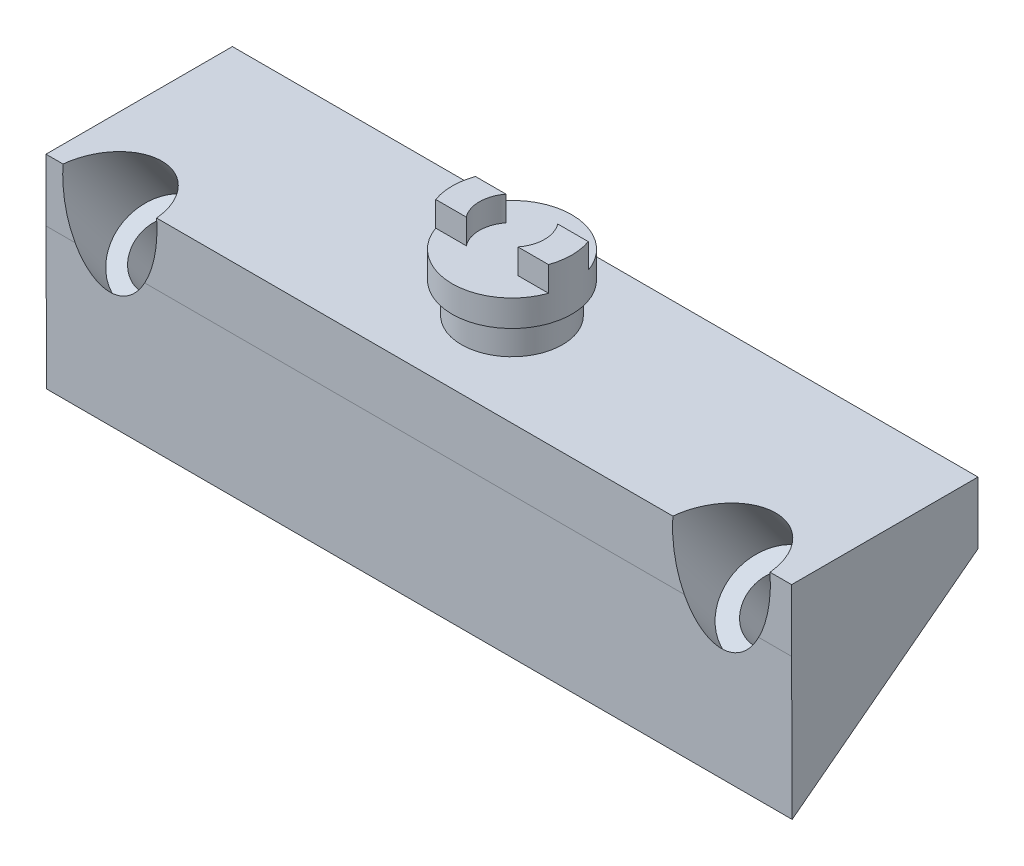
from build123d import *

# Parameters (mm, degrees)
SKETCH1_W                 = 48
SKETCH1_H                 = 12
BOSS_EXTRUDE2_DEPTH       = 4
SKETCH3_R                 = 3.25
BOSS_EXTRUDE3_DEPTH       = 2
SKETCH4_R                 = 3.85
BOSS_EXTRUDE4_DEPTH       = 3.3
SKETCH5_W                 = 10.744623103
SKETCH5_H                 = 3.104002229
SKETCH5_W_2               = 12.040799858
SKETCH5_H_2               = 4.707168217
CUT_EXTRUDE6_DEPTH        = 1.6
SKETCH6_R                 = 2.1
CUT_EXTRUDE7_DEPTH        = 1.6
BOSS_EXTRUDE5_DEPTH       = 48
SKETCH11_R                = 2
CUT_EXTRUDE12_DEPTH       = 46.960925441
CUT_EXTRUDE13_START       = -3.247821806
CUT_EXTRUDE13_OUTLINE_R   = 3.036171251
CUT_EXTRUDE13_OUTLINE_R_2 = 2
CUT_EXTRUDE13_OUTLINE_R_3 = 3.150431912
CUT_EXTRUDE13_DEPTH       = 6.452188627


# Read off the part's stored shape, not the designer's step: Cut-Extrude13
with BuildPart() as part:
    # Sketch1 → Boss-Extrude2 (new body)
    with BuildSketch(Plane(origin=(0, 0, 0), x_dir=(1, 0, 0), z_dir=(0, 1, 0))):
        with Locations((-18.755819717, 5.963784416)):
            Rectangle(SKETCH1_W, SKETCH1_H)
    extrude(amount=BOSS_EXTRUDE2_DEPTH)

    # Sketch3 → Boss-Extrude3 (add)
    with BuildSketch(Plane(origin=(0, 4, 0), x_dir=(1, 0, 0), z_dir=(0, 1, 0))):
        with Locations(Location((-18.755819717, 5.963784416, 0), (0, 0, 270))):
            Circle(SKETCH3_R)
    extrude(amount=BOSS_EXTRUDE3_DEPTH)

    # Sketch4 → Boss-Extrude4 (add)
    with BuildSketch(Plane(origin=(0, 6, 0), x_dir=(1, 0, 0), z_dir=(0, 1, 0))):
        with Locations(Location((-18.755819717, 5.963784416, 0), (0, 0, 270))):
            Circle(SKETCH4_R)
    extrude(amount=BOSS_EXTRUDE4_DEPTH)

    # Sketch5 → Cut-Extrude6 (cut)
    with BuildSketch(Plane(origin=(0, 9.3, 0), x_dir=(1, 0, 0), z_dir=(0, 1, 0))):
        with Locations((-18.784487645, 3.131783302)):
            Rectangle(SKETCH5_W, SKETCH5_H)
        with Locations((-18.682157901, 9.597368525)):
            Rectangle(SKETCH5_W_2, SKETCH5_H_2)
    extrude(amount=-CUT_EXTRUDE6_DEPTH, mode=Mode.SUBTRACT)

    # Sketch6 → Cut-Extrude7 (cut)
    with BuildSketch(Plane(origin=(0, 9.3, 0), x_dir=(1, 0, 0), z_dir=(0, 1, 0))):
        with Locations((-18.755819717, 5.963784416)):
            Circle(SKETCH6_R)
    extrude(amount=-CUT_EXTRUDE7_DEPTH, mode=Mode.SUBTRACT)

    # Sketch7 → Boss-Extrude5 (add)
    with BuildSketch(Plane(origin=(5.244180283, 0, 0), x_dir=(0, 0, -1), z_dir=(1, 0, 0))):
        Polygon((11.963784416, 0), (0, -9.109804798), (-0.036215584, 0), align=None)
    extrude(amount=-BOSS_EXTRUDE5_DEPTH)

    # Sketch11 → Cut-Extrude12 (cut, through all)
    with BuildSketch(Plane(origin=(0, -5.766415649, -4.390828112), x_dir=(1, 0, 0), z_dir=(0, -0.7956067081089262, -0.6058134746042532))):
        with Locations(Location((0.874180283, -1.977052592, 0), (0, 0, 270))):
            Circle(SKETCH11_R)
        with Locations(Location((-38.525819717, -1.977052592, 0), (0, 0, 270))):
            Circle(SKETCH11_R)
    extrude(amount=-CUT_EXTRUDE12_DEPTH, mode=Mode.SUBTRACT)

    # Cut-Extrude13 outline → Cut-Extrude13 (cut)
    # profile 1 of 2: a face of its own
    with BuildSketch(Plane(origin=(0, 0, 0), x_dir=(1, 0, 0), z_dir=(0, 0.7956067081089261, 0.6058134746042532)).offset(CUT_EXTRUDE13_START)):
        with Locations((-38.643729383, 2.019534021)):
            Circle(CUT_EXTRUDE13_OUTLINE_R)
        with Locations((-38.525819717, 1.977052592)):
            Circle(CUT_EXTRUDE13_OUTLINE_R_2, mode=Mode.SUBTRACT)
    # profile 2 of 2: a face of its own
    with BuildSketch(Plane(origin=(0, 0, 0), x_dir=(1, 0, 0), z_dir=(0, 0.7956067081089261, 0.6058134746042532)).offset(CUT_EXTRUDE13_START)):
        with Locations((0.730306236, 2.019534021)):
            Circle(CUT_EXTRUDE13_OUTLINE_R_3)
        with Locations((0.874180283, 1.977052592)):
            Circle(CUT_EXTRUDE13_OUTLINE_R_2, mode=Mode.SUBTRACT)
    extrude(amount=CUT_EXTRUDE13_DEPTH, mode=Mode.SUBTRACT)


solid = part.part
